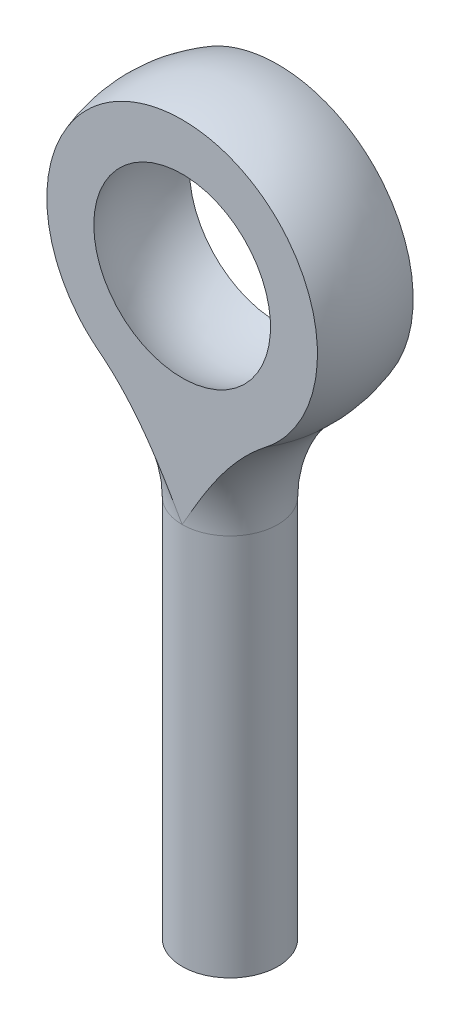
from build123d import *

# Parameters (mm, degrees)
CUT_EXTRUDE1_DEPTH      = 42.911202634
CUT_EXTRUDE1_DEPTH_BACK = 42.911202634
SKETCH3_W               = 8
SKETCH3_H               = 25


with BuildPart() as part:
    # Sketch2 → Revolve1 (revolve)
    with BuildSketch(Plane.XY):
        with BuildLine():
            Line((3.175, -39.6875), (3.175, -14.2875))
            ThreePointArc((3.175, -14.2875), (4.01304802, -10.338438009), (6.382731959, -7.070103093))
            ThreePointArc((6.382731959, -7.070103093), (8.890116899, 3.41927573), (0, 9.525))
            Line((0, 9.525), (0, -39.6875))
            Line((0, -39.6875), (3.175, -39.6875))
        make_face()
    revolve(axis=Axis((0, 9.525, 0), (0, -1, 0)))

    # Sketch3 → Cut-Extrude1 (cut, two sides: drawn at the far end of the back side and taken through both)
    with BuildSketch(Plane(origin=(0, 0, 0), x_dir=(0, 0, -1), z_dir=(1, 0, 0)).offset(-CUT_EXTRUDE1_DEPTH_BACK)):
        with Locations((-7.175, -1.7875)):
            Rectangle(SKETCH3_W, SKETCH3_H)
        with Locations((7.175, -1.7875)):
            Rectangle(SKETCH3_W, SKETCH3_H)
    extrude(amount=CUT_EXTRUDE1_DEPTH + CUT_EXTRUDE1_DEPTH_BACK, mode=Mode.SUBTRACT)

    # Sketch4 → Cut-Revolve2 (revolve, cut)
    with BuildSketch(Plane.XY):
        with BuildLine():
            Line((0, -6.6675), (0, 0))
            Line((0, 0), (0, 6.6675))
            ThreePointArc((0, 6.6675), (-6.6675, 0), (0, -6.6675))
        make_face()
    revolve(axis=Axis((0, 0, 0), (0, -1, 0)), mode=Mode.SUBTRACT)


solid = part.part
